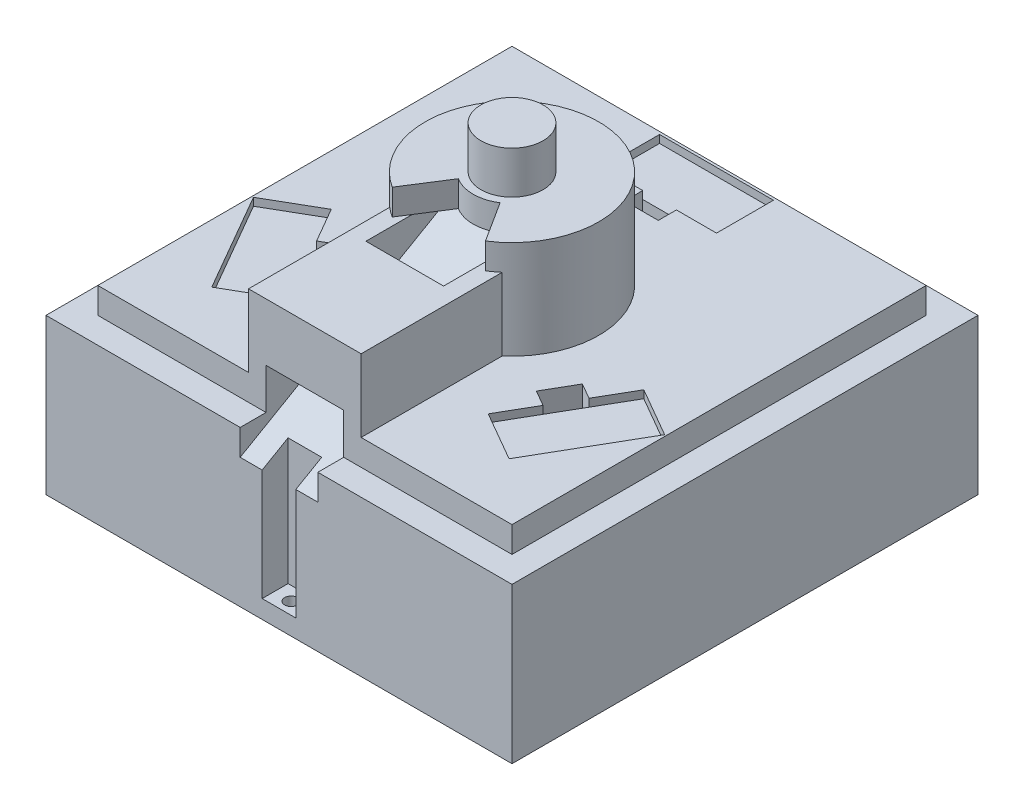
from build123d import *

# Parameters (mm, degrees)
SKETCH_3_W               = 180
SKETCH_3_H               = 180
EXTRUDE_1_DEPTH          = 70
SKETCH_5_OUTSIDE_W       = 234.802
SKETCH_5_OUTSIDE_H       = 234.802
SKETCH_5_OUTSIDE_W_2     = 160
SKETCH_5_OUTSIDE_H_2     = 160
CUT_EXTRUDE_1_DEPTH      = 10
SKETCH_6_W               = 13
SKETCH_6_H               = 10
CUT_EXTRUDE_2_DEPTH      = 53
CUT_EXTRUDE_3_REACH      = 147.258
SKETCH_7_R               = 2.5
SKETCH_8_R               = 4
CUT_EXTRUDE_4_DEPTH      = 2
SKETCH_9_R               = 33.5
EXTRUDE_2_DEPTH          = 38
SKETCH_10_R              = 12
EXTRUDE_3_DEPTH          = 16.4
SKETCH_11_W              = 44
SKETCH_11_H              = 22
CUT_EXTRUDE_5_DEPTH      = 3
PATTERN_CIRCULAR_1_COUNT = 3
CUT_EXTRUDE_6_REACH      = 147.258
SKETCH_12_W              = 13
SKETCH_12_H              = 7
PATTERN_CIRCULAR_2_COUNT = 3
SKETCH_13_W              = 160
SKETCH_13_H              = 155
CUT_EXTRUDE_7_DEPTH      = 50
CUT_EXTRUDE_START        = -10
CUT_EXTRUDE_8_DEPTH      = 10
SKETCH_20_W              = 43.47623614
SKETCH_20_H              = 54.53887657
EXTRUDE_4_DEPTH          = 28
SWEEP_START              = -15
SWEEP_2_DEPTH            = 30


# Read off the part's stored shape, not the designer's step: 切除-扫描2
with BuildPart() as part:
    # 草图3 → 凸台-拉伸1 (new body)
    with BuildSketch(Plane(origin=(0, 0, 0), x_dir=(1, 0, 0), z_dir=(0, 1, 0))):
        Rectangle(SKETCH_3_W, SKETCH_3_H)
    extrude(amount=EXTRUDE_1_DEPTH)

    # 草图5 outside → 切除-拉伸1 (cut)
    with BuildSketch(Plane(origin=(0, 70, 0), x_dir=(1, 0, 0), z_dir=(0, 1, 0))):
        Rectangle(SKETCH_5_OUTSIDE_W, SKETCH_5_OUTSIDE_H)
        Rectangle(SKETCH_5_OUTSIDE_W_2, SKETCH_5_OUTSIDE_H_2, mode=Mode.SUBTRACT)
    extrude(amount=-CUT_EXTRUDE_1_DEPTH, mode=Mode.SUBTRACT)

    # 草图6 → 切除-拉伸2 (cut)
    with BuildSketch(Plane(origin=(0, 60, 0), x_dir=(1, 0, 0), z_dir=(0, 1, 0))):
        with Locations((0, -85)):
            Rectangle(SKETCH_6_W, SKETCH_6_H)
    extrude(amount=-CUT_EXTRUDE_2_DEPTH, mode=Mode.SUBTRACT)

    # 草图7 → 切除-拉伸3 (cut, up to next)
    with BuildSketch(Plane.XZ, mode=Mode.PRIVATE) as cut_extrude_3_sk1:
        with Locations(Location((0, 85.3, 0), (0, 0, 270))):
            Circle(SKETCH_7_R)
    cut_extrude_3_tool1 = extrude(cut_extrude_3_sk1.sketch, amount=-CUT_EXTRUDE_3_REACH, mode=Mode.PRIVATE) & part.part
    add(cut_extrude_3_tool1.solids().sort_by_distance((0, 0, 85.3))[0], mode=Mode.SUBTRACT)

    # 草图8 → 切除-拉伸4 (cut)
    with BuildSketch(Plane.XZ):
        with Locations(Location((0, 85.3, 0), (0, 0, 270))):
            Circle(SKETCH_8_R)
    extrude(amount=-CUT_EXTRUDE_4_DEPTH, mode=Mode.SUBTRACT)

    # 草图9 → 凸台-拉伸2 (add)
    with BuildSketch(Plane(origin=(0, 70, 0), x_dir=(1, 0, 0), z_dir=(0, 1, 0))):
        with Locations(Location((0, 0, 0), (0, 0, 270))):
            Circle(SKETCH_9_R)
    extrude(amount=EXTRUDE_2_DEPTH)

    # 草图10 → 凸台-拉伸3 (add)
    with BuildSketch(Plane(origin=(0, 108, 0), x_dir=(1, 0, 0), z_dir=(0, 1, 0))):
        with Locations(Location((0, 0, 0), (0, 0, 270))):
            Circle(SKETCH_10_R)
    extrude(amount=EXTRUDE_3_DEPTH)

    # 草图11 → 切除-拉伸5 (cut)
    with BuildSketch(Plane(origin=(0, 70, 0), x_dir=(1, 0, 0), z_dir=(0, 1, 0))):
        with Locations((0, 68)):
            Rectangle(SKETCH_11_W, SKETCH_11_H)
    cut_extrude_5 = extrude(amount=-CUT_EXTRUDE_5_DEPTH, mode=Mode.SUBTRACT)

    # 阵列(圆周)1: 切除-拉伸5 ×3 about axis
    pattern_circular_1_axis = Axis((0, 0, 0), (0, 1, 0))
    for i in range(1, PATTERN_CIRCULAR_1_COUNT):
        add(cut_extrude_5.rotate(pattern_circular_1_axis, i * 360 / PATTERN_CIRCULAR_1_COUNT), mode=Mode.SUBTRACT)

    # 草图12 → 切除-拉伸6 (cut, up to next)
    with BuildSketch(Plane(origin=(0, 70, 0), x_dir=(1, 0, 0), z_dir=(0, 1, 0)), mode=Mode.PRIVATE) as cut_extrude_6_sk1:
        with Locations((0, 53.5)):
            Rectangle(SKETCH_12_W, SKETCH_12_H)
    cut_extrude_6_tool1 = extrude(cut_extrude_6_sk1.sketch, amount=-CUT_EXTRUDE_6_REACH, mode=Mode.PRIVATE) & part.part
    cut_extrude_6 = cut_extrude_6_tool1.solids().sort_by_distance((0, 70, -53.5))[0]
    add(cut_extrude_6, mode=Mode.SUBTRACT)

    # 阵列(圆周)2: 切除-拉伸6 ×3 about axis
    pattern_circular_2_axis = Axis((0, 0, 0), (0, 1, 0))
    for i in range(1, PATTERN_CIRCULAR_2_COUNT):
        add(cut_extrude_6.rotate(pattern_circular_2_axis, i * 360 / PATTERN_CIRCULAR_2_COUNT), mode=Mode.SUBTRACT)

    # 草图13 → 切除-拉伸7 (cut)
    with BuildSketch(Plane.XZ):
        with Locations((0, -2.5)):
            Rectangle(SKETCH_13_W, SKETCH_13_H)
    extrude(amount=-CUT_EXTRUDE_7_DEPTH, mode=Mode.SUBTRACT)

    # 草图14 → 切除-拉伸8 (cut)
    with BuildSketch(Plane(origin=(0, 108, 0), x_dir=(1, 0, 0), z_dir=(0, 1, 0)).offset(CUT_EXTRUDE_START)):
        with BuildLine():
            Line((-8.059494125, -12.650871687), (-17.99953688, -28.253613435))
            ThreePointArc((-17.99953688, -28.253613435), (0, -33.5), (17.99953688, -28.253613435))
            Line((17.99953688, -28.253613435), (8.059494125, -12.650871687))
            ThreePointArc((8.059494125, -12.650871687), (0, -15), (-8.059494125, -12.650871687))
        make_face()
    extrude(amount=CUT_EXTRUDE_8_DEPTH, mode=Mode.SUBTRACT)

    # 草图20 → 凸台-拉伸4 (add)
    with BuildSketch(Plane(origin=(0, 70, 0), x_dir=(1, 0, 0), z_dir=(0, 1, 0))):
        with Locations((-0.01436765, -52.730561715)):
            Rectangle(SKETCH_20_W, SKETCH_20_H)
    extrude(amount=EXTRUDE_4_DEPTH)

    # 切除-扫描2 outline → 切除-扫描2 (cut)
    with BuildSketch(Plane.YZ.offset(SWEEP_START)):
        Polygon((98, 6.738189634), (98, 41.43061062), (75.764947914, 80), (60, 80), (60, 90), (50, 90), align=None)
    extrude(amount=SWEEP_2_DEPTH, mode=Mode.SUBTRACT)


solid = part.part
